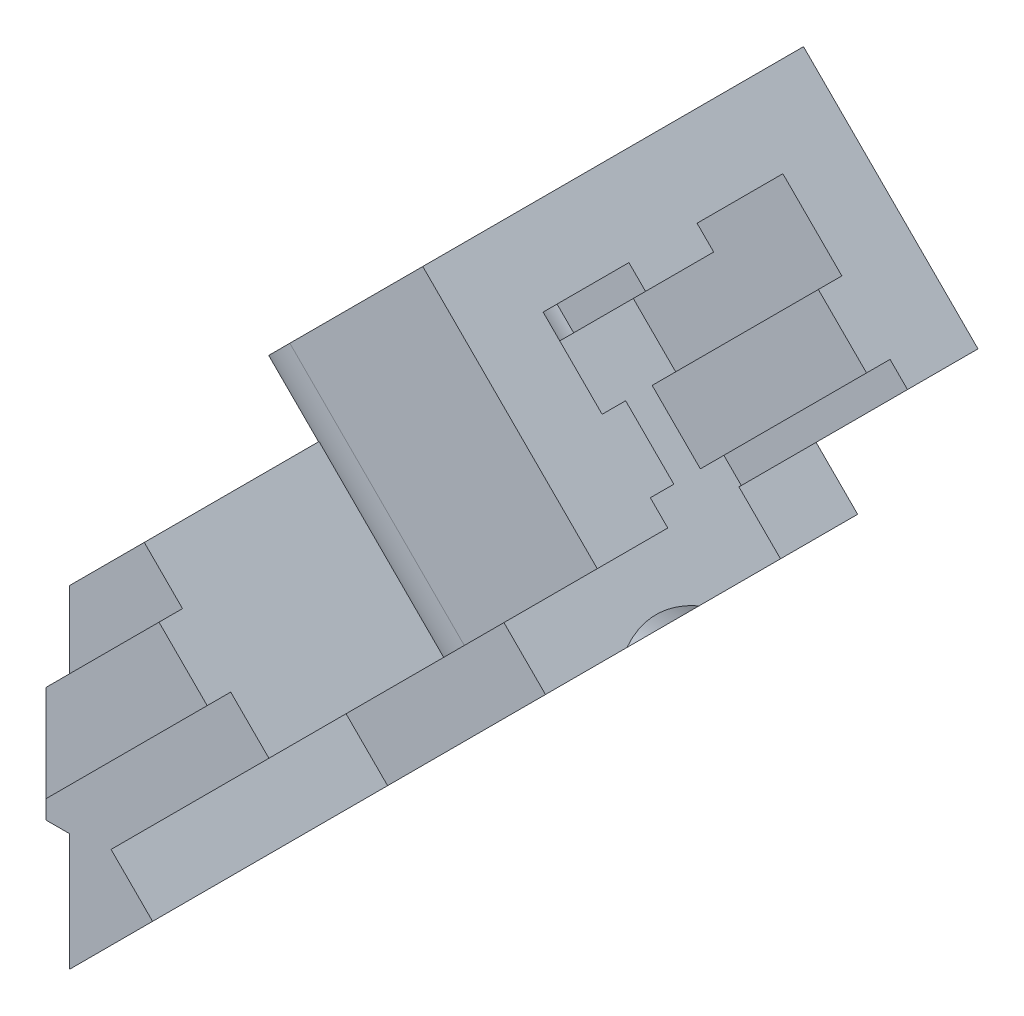
from build123d import *

# Parameters (mm, degrees)
MAIN_EXTRUSION_DEPTH                   = 15
ESQUISSE2_W                            = 10
ESQUISSE2_H                            = 9.5
WINDOW_EXTRUSION_DEPTH                 = 2.5
ESQUISSE5_R                            = 1.25
WINDOW_HOLE_EXTRUSION_DEPTH            = 25.728526038
FIXATION_TOP_MAKERBEAM_EXTRUSION_DEPTH = 10
ESQUISSE3_R                            = 1.5
WINDOW_HOLE_FIXATION_DEPTH             = 34.079263873
ESQUISSE4_R                            = 4.1
CENTRAL_FIXATION_DEPTH                 = 32.269584341
BOSS_EXTRU_2_DEPTH                     = 1
BOSS_EXTRU_6_DEPTH                     = 12
CONG_1_R                               = 4
ESQUISSE11_R                           = 1.6
ENL_V_MAT_EXTRU_2_DEPTH                = 35.185157598


with BuildPart() as part:
    # Esquisse1 → Main Extrusion (new, symmetric)
    with BuildSketch(Plane.XY):
        Polygon((0, 0), (0, 5), (-1, 5), (-1, 7.9), (0, 7.9), (0, 14.142135624), (3.181980515, 17.324116139), (10.253048327, 10.253048327), align=None)
    extrude(amount=MAIN_EXTRUSION_DEPTH, both=True)

    # Esquisse2 → Window Extrusion (cut)
    with BuildSketch(Plane(origin=(0, 0, 0), x_dir=(0, 0, -1), z_dir=(0.7071067811865512, -0.7071067811865438, 0))):
        with Locations((10, 9.75)):
            Rectangle(ESQUISSE2_W, ESQUISSE2_H)
    window_extrusion = extrude(amount=-WINDOW_EXTRUSION_DEPTH, mode=Mode.SUBTRACT)

    # Esquisse5 → Window Hole Extrusion (cut, through all)
    with BuildSketch(Plane(origin=(-1.767766953, 1.767766953, 0), x_dir=(0, 0, -1), z_dir=(0.7071067811865513, -0.7071067811865438, 0))):
        with Locations((10, 11.5)):
            Circle(ESQUISSE5_R)
    window_hole_extrusion = extrude(amount=-WINDOW_HOLE_EXTRUSION_DEPTH, mode=Mode.SUBTRACT)

    # Esquisse7 → Fixation Top MakerBeam Extrusion (add)
    with BuildSketch(Plane(origin=(10.253048327, 10.253048327, 0), x_dir=(0, 0, -1), z_dir=(0.7071067811865438, 0.7071067811865513, 0))):
        Polygon((-5.1, 2.5), (-5.1, 3.55), (-4.1, 3.55), (-4.1, 6.45), (-5.1, 6.45), (-5.1, 10), (-8.1, 10), (-8.1, 2.5), align=None)
    fixation_top_makerbeam_extrusion = extrude(amount=FIXATION_TOP_MAKERBEAM_EXTRUSION_DEPTH)

    # Window Symetry: Window Extrusion, Window Hole Extrusion, Fixation Top MakerBeam Extrusion across plane
    add(window_extrusion.mirror(Plane.XY), mode=Mode.SUBTRACT)
    add(window_hole_extrusion.mirror(Plane.XY), mode=Mode.SUBTRACT)
    add(fixation_top_makerbeam_extrusion.mirror(Plane.XY))

    # Esquisse3 → Window Hole Fixation (cut, through all)
    with BuildSketch(Plane.ZY.offset(1)):
        with Locations((0, 6.45)):
            Circle(ESQUISSE3_R)
    extrude(amount=-WINDOW_HOLE_FIXATION_DEPTH, mode=Mode.SUBTRACT)

    # Esquisse4 → Central Fixation (cut, through all)
    with BuildSketch(Plane.ZY.offset(-3)):
        with Locations((0, 6.45)):
            Circle(ESQUISSE4_R)
    extrude(amount=-CENTRAL_FIXATION_DEPTH, mode=Mode.SUBTRACT)

    # Esquisse6 → Boss.-Extru.2 (add)
    with BuildSketch(Plane.XY.offset(15)):
        Polygon((0, 10.88944443), (4.808326112, 15.697770542), (6.858935778, 13.647160877), (0, 6.788225099), align=None)
    extrude(amount=BOSS_EXTRU_2_DEPTH)

    # Esquisse8 → Boss.-Extru.6 (add)
    with BuildSketch(Plane(origin=(17.324116139, 17.324116139, 0), x_dir=(0, 0, -1), z_dir=(0.7071067811865434, 0.7071067811865517, 0))):
        Polygon((-8.1, 10), (-1.45, 10), (-1.45, 9), (1.45, 9), (1.45, 10), (8.1, 10), (8.1, 13), (-8.1, 13), align=None)
    extrude(amount=-BOSS_EXTRU_6_DEPTH)

    # Congé1
    cong_1_edges = [part.edges().sort_by_distance(p)[0] for p in [
        (0.707106781, 16.970562748, -8.1),
        (0.707106781, 16.970562748, 8.1),
    ]]
    fillet(cong_1_edges, radius=CONG_1_R)

    # Esquisse11 → Enlèv. mat.-Extru.2 (cut, through all)
    with BuildSketch(Plane(origin=(-9.192388155, 9.192388155, 0), x_dir=(0, 0, 1), z_dir=(-0.7071067811865517, 0.7071067811865434, 0))):
        with Locations((0, 19.5)):
            Circle(ESQUISSE11_R)
    extrude(amount=-ENL_V_MAT_EXTRU_2_DEPTH, mode=Mode.SUBTRACT)


solid = part.part
